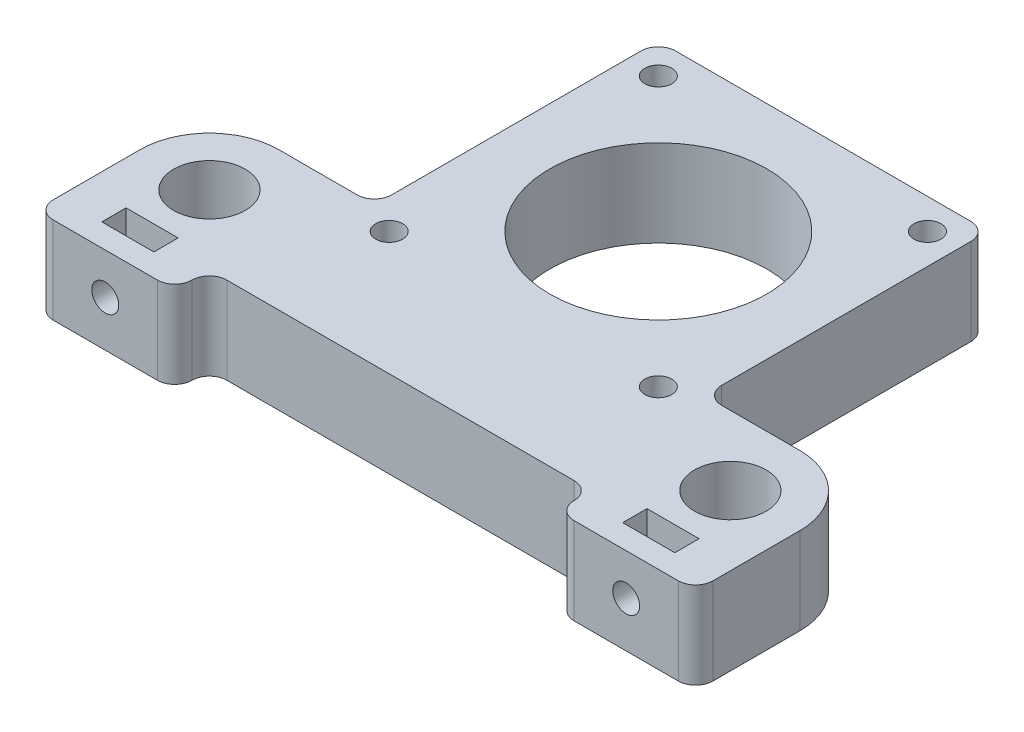
from build123d import *

# Parameters (mm, degrees)
SKETCH1_W           = 16
SKETCH1_H           = 4
SKETCH1_W_2         = 76
SKETCH1_H_2         = 16
SKETCH1_R           = 4.125
BOSS_EXTRUDE1_DEPTH = 10
SKETCH2_W           = 6
SKETCH2_H           = 2.8
CUT_EXTRUDE1_DEPTH  = 10
SKETCH3_R           = 1.55
CUT_EXTRUDE2_DEPTH  = 10
FILLET1_R           = 8
FILLET2_R           = 2
SKETCH4_W           = 38
SKETCH4_H           = 32.700002283
SKETCH4_R           = 1.55
SKETCH4_R_2         = 12.5
BOSS_EXTRUDE2_DEPTH = 10
CUT_EXTRUDE3_DEPTH  = 10
FILLET4_R           = 2


with BuildPart() as part:
    # Sketch1 → Boss-Extrude1 (new body)
    # profile 1 of 3: a face of its own
    with BuildSketch(Plane(origin=(0, 0, 0), x_dir=(1, 0, 0), z_dir=(0, 1, 0))):
        with Locations((-30, -10)):
            Rectangle(SKETCH1_W, SKETCH1_H)
    # profile 2 of 3: a face of its own
    with BuildSketch(Plane(origin=(0, 0, 0), x_dir=(1, 0, 0), z_dir=(0, 1, 0))):
        Rectangle(SKETCH1_W_2, SKETCH1_H_2)
        with Locations(Location((30, 0, 0), (0, 0, 270))):
            Circle(SKETCH1_R, mode=Mode.SUBTRACT)
        with Locations(Location((-30, 2.283e-06, 0), (0, 0, 270))):
            Circle(SKETCH1_R, mode=Mode.SUBTRACT)
    # profile 3 of 3: a face of its own
    with BuildSketch(Plane(origin=(0, 0, 0), x_dir=(1, 0, 0), z_dir=(0, 1, 0))):
        with Locations((30, -10)):
            Rectangle(SKETCH1_W, SKETCH1_H)
    extrude(amount=BOSS_EXTRUDE1_DEPTH)

    # Sketch2 → Cut-Extrude1 (cut)
    with BuildSketch(Plane(origin=(0, 10, 0), x_dir=(1, 0, 0), z_dir=(0, 1, 0))):
        with Locations((-30, -7.999997717)):
            Rectangle(SKETCH2_W, SKETCH2_H)
    cut_extrude1 = extrude(amount=-CUT_EXTRUDE1_DEPTH, mode=Mode.SUBTRACT)

    # Sketch3 → Cut-Extrude2 (cut)
    with BuildSketch(Plane.XY.offset(12)):
        with Locations((-30, 5.258558289)):
            Circle(SKETCH3_R)
    cut_extrude2 = extrude(amount=-CUT_EXTRUDE2_DEPTH, mode=Mode.SUBTRACT)

    # Mirror1: Cut-Extrude1, Cut-Extrude2 across plane
    add(cut_extrude1.mirror(Plane(origin=(0, 0, 0), x_dir=(0, 0, 1), z_dir=(1, 0, 0))), mode=Mode.SUBTRACT)
    add(cut_extrude2.mirror(Plane(origin=(0, 0, 0), x_dir=(0, 0, 1), z_dir=(1, 0, 0))), mode=Mode.SUBTRACT)

    # Fillet1
    fillet1_edges = [part.edges().sort_by_distance(p)[0] for p in [
        (-38, 5, -8),
        (38, 5, -8),
    ]]
    fillet(fillet1_edges, radius=FILLET1_R)

    # Fillet2
    fillet2_edges = [part.edges().sort_by_distance(p)[0] for p in [
        (38, 5, 12),
        (22, 5, 12),
        (22, 5, 8),
        (-22, 5, 8),
        (-22, 5, 12),
        (-38, 5, 12),
    ]]
    fillet(fillet2_edges, radius=FILLET2_R - 0.0001)  # a hair under: the kernel refuses the full size

    # Sketch4 → Boss-Extrude2 (add)
    with BuildSketch(Plane.XZ):
        with Locations((0, -24.350001142)):
            Rectangle(SKETCH4_W, SKETCH4_H)
        with Locations(Location((15.5, -37.200002283, 0), (0, 0, 270))):
            Circle(SKETCH4_R, mode=Mode.SUBTRACT)
        with Locations(Location((-15.5, -37.200002283, 0), (0, 0, 270))):
            Circle(SKETCH4_R, mode=Mode.SUBTRACT)
        with Locations(Location((0, -21.700002283, 0), (0, 0, 270))):
            Circle(SKETCH4_R_2, mode=Mode.SUBTRACT)
    extrude(amount=-BOSS_EXTRUDE2_DEPTH)

    # Sketch4<3> → Cut-Extrude3 (cut)
    with BuildSketch(Plane.XZ):
        with BuildLine():
            ThreePointArc((17.05, -6.200002283), (15.5, -4.650002283), (13.95, -6.200002283))
            Line((13.95, -6.200002283), (15.5, -6.200002283))
            Line((15.5, -6.200002283), (15.5, -7.750002283))
            ThreePointArc((15.5, -7.750002283), (16.596015511, -7.296017794), (17.05, -6.200002283))
        make_face()
        with BuildLine():
            Line((15.5, -6.200002283), (13.95, -6.200002283))
            ThreePointArc((13.95, -6.200002283), (14.403984489, -7.296017794), (15.5, -7.750002283))
            Line((15.5, -7.750002283), (15.5, -6.200002283))
        make_face()
        with BuildLine():
            Line((-15.5, -7.750002283), (-15.5, -6.200002283))
            Line((-15.5, -6.200002283), (-13.95, -6.200002283))
            ThreePointArc((-13.95, -6.200002283), (-16.596015511, -5.103986772), (-15.5, -7.750002283))
        make_face()
        with BuildLine():
            Line((-13.95, -6.200002283), (-15.5, -6.200002283))
            Line((-15.5, -6.200002283), (-15.5, -7.750002283))
            ThreePointArc((-15.5, -7.750002283), (-14.403984489, -7.296017794), (-13.95, -6.200002283))
        make_face()
    extrude(amount=-CUT_EXTRUDE3_DEPTH, mode=Mode.SUBTRACT)

    # Fillet4
    fillet4_edges = [part.edges().sort_by_distance(p)[0] for p in [
        (19, 5, -8),
        (-19, 5, -8),
        (19, 5, -40.700002283),
        (-19, 5, -40.700002283),
    ]]
    fillet(fillet4_edges, radius=FILLET4_R)


solid = part.part
